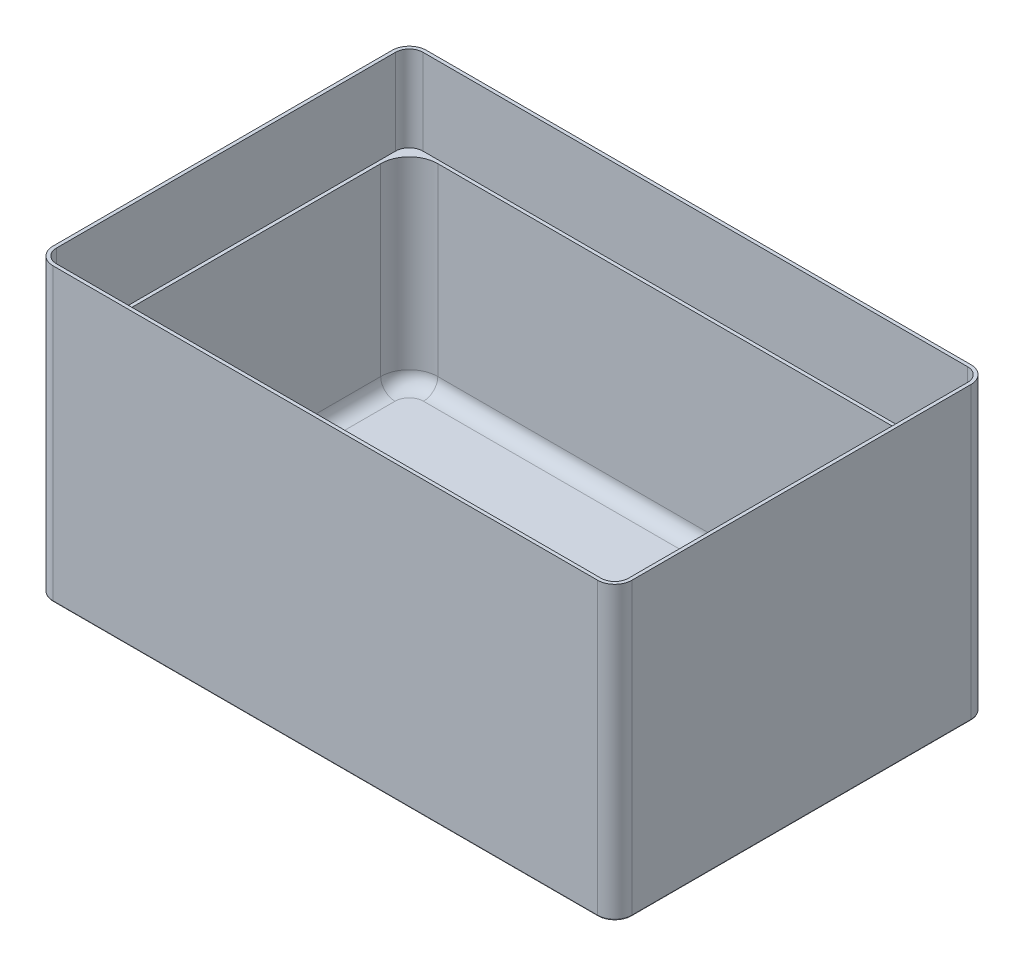
from build123d import *

# Parameters (mm, degrees)
SKETCH1_W           = 202.8
SKETCH1_H           = 130.8
SKETCH1_W_2         = 198
SKETCH1_H_2         = 126
BOSS_EXTRUDE1_DEPTH = 102
SKETCH3_W           = 198
SKETCH3_H           = 126
BOSS_EXTRUDE3_DEPTH = 2.4
FILLET1_R           = 5
FILLET4_R           = 10
FILLET2_R           = 6
FILLET3_R           = 0.4
CUT_EXTRUDE1_DEPTH  = 30


with BuildPart() as part:
    # Sketch1 → Boss-Extrude1 (new body)
    with BuildSketch(Plane(origin=(0, 0, 0), x_dir=(1, 0, 0), z_dir=(0, 1, 0))):
        with Locations((99, -63)):
            Rectangle(SKETCH1_W, SKETCH1_H)
        with Locations((99, -63)):
            Rectangle(SKETCH1_W_2, SKETCH1_H_2, mode=Mode.SUBTRACT)
    extrude(amount=BOSS_EXTRUDE1_DEPTH)

    # Sketch3 → Boss-Extrude3 (add)
    with BuildSketch(Plane(origin=(0, 0, 0), x_dir=(-1, 0, 0), z_dir=(0, -1, 0))):
        with Locations((-99, -63)):
            Rectangle(SKETCH3_W, SKETCH3_H)
    extrude(amount=-BOSS_EXTRUDE3_DEPTH)

    # Fillet1
    fillet1_edges = [part.edges().sort_by_distance(p)[0] for p in [
        (0, 2.4, 63),
        (99, 2.4, 126),
        (198, 2.4, 63),
        (99, 2.4, 0),
    ]]
    fillet(fillet1_edges, radius=FILLET1_R)

    # Fillet4
    # the kernel refuses this fillet: 10 mm, written as the material it adds along each edge
    with BuildSketch(Plane(origin=(10, 2.4, 10), x_dir=(-1, 0, 0), z_dir=(0, 0, 1))) as fillet4_piece_1:
        with BuildLine():
            CenterArc((5, -5), 5, 0, 90)
            Line((10, -5), (10, 0))
            Line((10, 0), (5, 0))
        make_face()
    revolve(axis=Axis((10, 2.4, 10), (0, -1, 0)), revolution_arc=90)
    with BuildSketch(Plane(origin=(10, 2.4, 116), x_dir=(0, 0, 1), z_dir=(1, 0, 0))) as fillet4_piece_2:
        with BuildLine():
            CenterArc((5, -5), 5, 0, 90)
            Line((10, -5), (10, 0))
            Line((10, 0), (5, 0))
        make_face()
    revolve(axis=Axis((10, 2.4, 116), (0, -1, 0)), revolution_arc=90)
    with BuildSketch(Plane(origin=(188, 2.4, 10), x_dir=(0, 0, -1), z_dir=(-1, 0, 0))) as fillet4_piece_3:
        with BuildLine():
            CenterArc((5, -5), 5, 0, 90)
            Line((10, -5), (10, 0))
            Line((10, 0), (5, 0))
        make_face()
    revolve(axis=Axis((188, 2.4, 10), (0, -1, 0)), revolution_arc=90)
    with BuildSketch(Plane(origin=(188, 2.4, 116), x_dir=(1, 0, 0), z_dir=(0, 0, -1))) as fillet4_piece_4:
        with BuildLine():
            CenterArc((5, -5), 5, 0, 90)
            Line((10, -5), (10, 0))
            Line((10, 0), (5, 0))
        make_face()
    revolve(axis=Axis((188, 2.4, 116), (0, -1, 0)), revolution_arc=90)
    with BuildSketch(Plane(origin=(0, 2.4, 0), x_dir=(1, 0, 0), z_dir=(0, 1, 0)), Plane(origin=(0, 2.4, 126), x_dir=(0, 0, -1), z_dir=(0, 1, 0))) as fillet4_piece_5:
        with BuildLine():
            CenterArc((FILLET4_R, -FILLET4_R), FILLET4_R, 90, 90)
            Line((0, -FILLET4_R), (0, 0))
            Line((0, 0), (FILLET4_R, 0))
        make_face()
    extrude(amount=99.6)
    with BuildSketch(Plane(origin=(198, 2.4, 126), x_dir=(0, 0, -1), z_dir=(0, 1, 0)), Plane(origin=(198, 2.4, 0), x_dir=(-1, 0, 0), z_dir=(0, 1, 0))) as fillet4_piece_6:
        with BuildLine():
            CenterArc((FILLET4_R, FILLET4_R), FILLET4_R, 180, 90)
            Line((0, FILLET4_R), (0, 0))
            Line((0, 0), (FILLET4_R, 0))
        make_face()
    extrude(amount=99.6)

    # Fillet2
    fillet2_edges = [part.edges().sort_by_distance(p)[0] for p in [
        (200.4, 51, -2.4),
        (200.4, 51, 128.4),
        (-2.4, 51, 128.4),
        (-2.4, 51, -2.4),
    ]]
    fillet(fillet2_edges, radius=FILLET2_R)

    # Fillet3
    fillet3_edges = [part.edges().sort_by_distance(p)[0] for p in [
        (99, 0, -2.4),
        (200.4, 0, 63),
        (-2.4, 0, 63),
        (198.642640687, 0, 126.642640687),
        (198.642640687, 0, -0.642640687),
        (-0.642640687, 0, -0.642640687),
        (-0.642640687, 0, 126.642640687),
        (99, 0, 128.4),
    ]]
    fillet(fillet3_edges, radius=FILLET3_R)

    # Sketch7 → Cut-Extrude1 (cut)
    with BuildSketch(Plane(origin=(0, 102, 0), x_dir=(1, 0, 0), z_dir=(0, 1, 0))):
        with BuildLine():
            Line((3.6, -127.2), (194.4, -127.2))
            ThreePointArc((194.4, -127.2), (197.79411255, -125.79411255), (199.2, -122.4))
            Line((199.2, -122.4), (199.2, -3.6))
            ThreePointArc((199.2, -3.6), (197.79411255, -0.20588745), (194.4, 1.2))
            Line((194.4, 1.2), (3.6, 1.2))
            ThreePointArc((3.6, 1.2), (0.20588745, -0.20588745), (-1.2, -3.6))
            Line((-1.2, -3.6), (-1.2, -122.4))
            ThreePointArc((-1.2, -122.4), (0.20588745, -125.79411255), (3.6, -127.2))
        make_face()
    extrude(amount=-CUT_EXTRUDE1_DEPTH, mode=Mode.SUBTRACT)


solid = part.part
